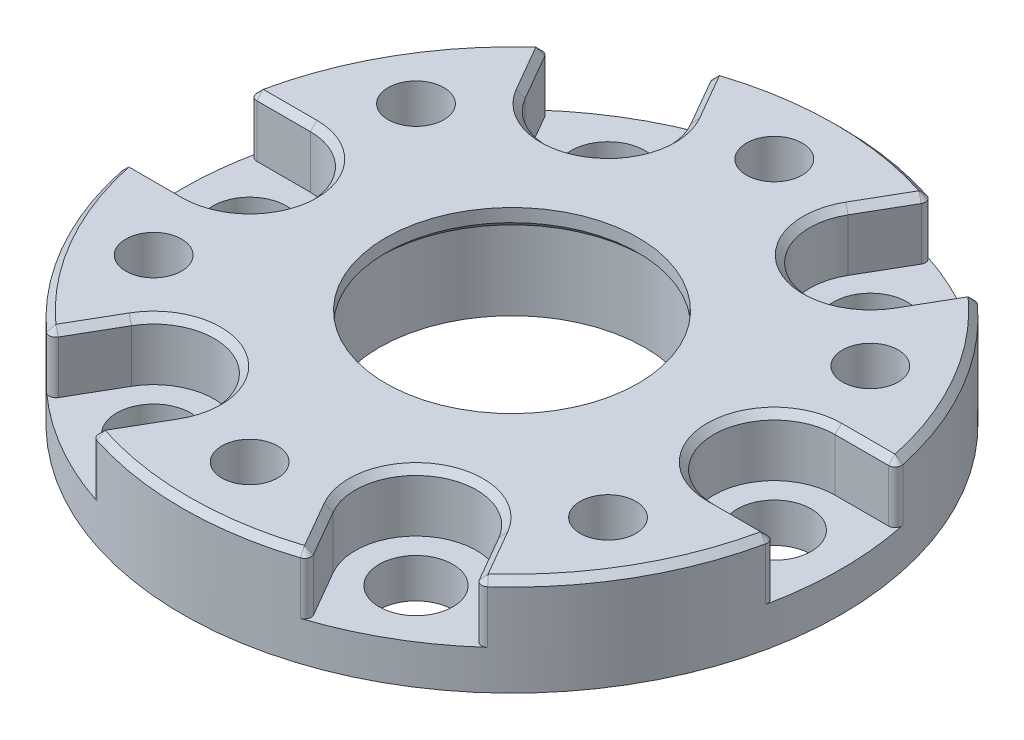
from build123d import *

# Parameters (mm, degrees)
CUT_EXTRUDE1_DEPTH           = 3.6
M4_CLEARANCE_HOLE1_D         = 4.5
CUT_EXTRUDE2_DEPTH           = 2.6
M3_CLEARANCE_HOLE2_D         = 3.4
FILLET1_R                    = 0.4
CHAMFER1_SIZE                = 1
CIRPATTERN1_COUNT            = 6
FILLET1_OF_CIRPATTERN1_R     = 0.4
CHAMFER1_OF_CIRPATTERN1_SIZE = 1
CHAMFER2_SIZE                = 0.4


with BuildPart() as part:
    # Sketch1 → Revolve1 (revolve)
    with BuildSketch(Plane.XY, mode=Mode.PRIVATE) as revolve1_sk:
        Polygon((8.1, 0), (20.1, 0), (20.1, 6), (7.7, 6), (7.7, 5.2), (8.1, 4.8), align=None)
    revolve(revolve1_sk.sketch.rotate(Axis((0, 16.469304641, 0), (0, -1, 0)), 180), axis=Axis((0, 16.469304641, 0), (0, -1, 0)))

    # Sketch2 → Cut-Extrude1 (cut)
    with BuildSketch(Plane(origin=(0, 6, 0), x_dir=(1, 0, 0), z_dir=(0, 1, 0))):
        with BuildLine():
            Line((16, 3.7), (19.756517912, 3.7))
            ThreePointArc((19.756517912, 3.7), (20.1, 0), (19.756517912, -3.7))
            Line((19.756517912, -3.7), (16, -3.7))
            ThreePointArc((16, -3.7), (12.3, 0), (16, 3.7))
        make_face()
    cut_extrude1 = extrude(amount=-CUT_EXTRUDE1_DEPTH, mode=Mode.SUBTRACT)

    # M4 Clearance Hole1 (through all)
    with Locations(Plane(origin=(0, 2.4, 0), x_dir=(1, 0, 0), z_dir=(0, 1, 0))):
        with Locations((16, 0)):
            m4_clearance_hole1 = Hole(M4_CLEARANCE_HOLE1_D / 2)

    # Sketch8 → Cut-Extrude2 (cut)
    with BuildSketch(Plane.XZ):
        Polygon((3.233161507, -16), (1.616580754, -13.2), (-1.616580754, -13.2), (-3.233161507, -16), (-1.616580754, -18.8), (1.616580754, -18.8), align=None)
    cut_extrude2 = extrude(amount=-CUT_EXTRUDE2_DEPTH, mode=Mode.SUBTRACT)

    # M3 Clearance Hole2 (through all)
    with Locations(Plane(origin=(0, 2.6, 0), x_dir=(-1, 0, 0), z_dir=(0, -1, 0))):
        with Locations((0, 16)):
            m3_clearance_hole2 = Hole(M3_CLEARANCE_HOLE2_D / 2)

    # Fillet1
    fillet1_edges = [part.edges().sort_by_distance(p)[0] for p in [
        (19.756517912, 4.2, -3.7),
        (19.756517912, 4.2, 3.7),
    ]]
    fillet(fillet1_edges, radius=FILLET1_R)

    # Chamfer1
    chamfer1_edges = [part.edges().sort_by_distance(p)[0] for p in [
        (-1.7, 2.6, -16),
    ]]
    chamfer(chamfer1_edges, length=CHAMFER1_SIZE)

    # CirPattern1: Cut-Extrude1, M4 Clearance Hole1, Cut-Extrude2, M3 Clearance Hole2 ×6 about axis
    cirpattern1_axis = Axis((0, 0, 0), (0, 1, 0))
    add([cut_extrude1.rotate(cirpattern1_axis, i * 360 / CIRPATTERN1_COUNT) for i in range(1, CIRPATTERN1_COUNT)], mode=Mode.SUBTRACT)
    add([m4_clearance_hole1.rotate(cirpattern1_axis, i * 360 / CIRPATTERN1_COUNT) for i in range(1, CIRPATTERN1_COUNT)], mode=Mode.SUBTRACT)
    add([cut_extrude2.rotate(cirpattern1_axis, i * 360 / CIRPATTERN1_COUNT) for i in range(1, CIRPATTERN1_COUNT)], mode=Mode.SUBTRACT)
    add([m3_clearance_hole2.rotate(cirpattern1_axis, i * 360 / CIRPATTERN1_COUNT) for i in range(1, CIRPATTERN1_COUNT)], mode=Mode.SUBTRACT)

    # Fillet1 of CirPattern1
    fillet1_of_cirpattern1_edges = [part.edges().sort_by_distance(p)[0] for p in [
        (6.673964962, 4.2, -18.959646402),
        (13.08255295, 4.2, -15.259646402),
        (-13.08255295, 4.2, -15.259646402),
        (-6.673964962, 4.2, -18.959646402),
        (-19.756517912, 4.2, 3.7),
        (-19.756517912, 4.2, -3.7),
        (-6.673964962, 4.2, 18.959646402),
        (-13.08255295, 4.2, 15.259646402),
        (13.08255295, 4.2, 15.259646402),
        (6.673964962, 4.2, 18.959646402),
    ]]
    fillet(fillet1_of_cirpattern1_edges, radius=FILLET1_OF_CIRPATTERN1_R)

    # Chamfer1 of CirPattern1
    chamfer1_of_cirpattern1_edges = [part.edges().sort_by_distance(p)[0] for p in [
        (-14.706406461, 2.6, -6.527756814),
        (-13.006406461, 2.6, 9.472243186),
        (1.7, 2.6, 16),
        (14.706406461, 2.6, 6.527756814),
        (13.006406461, 2.6, -9.472243186),
    ]]
    chamfer(chamfer1_of_cirpattern1_edges, length=CHAMFER1_OF_CIRPATTERN1_SIZE)

    # Chamfer2
    chamfer2_edges = [part.edges().sort_by_distance(p)[0] for p in [
        (6.15, 6, 10.652112467),
        (5.612862844, 6, 17.121763621),
        (-6.15, 6, 10.652112467),
        (-12.021450832, 6, 13.421763621),
        (-12.3, 6, 0),
        (-17.634313676, 6, -3.7),
        (-6.15, 6, -10.652112467),
        (-5.612862844, 6, -17.121763621),
        (6.15, 6, -10.652112467),
        (12.021450832, 6, -13.421763621),
        (12.3, 6, 0),
        (17.634313676, 6, 3.7),
        (5.612862844, 6, -17.121763621),
        (0, 6, -20.1),
        (13.122486484, 6, -15.032202838),
        (6.45702629, 6, -18.880508075),
        (-12.021450832, 6, -13.421763621),
        (-17.407110616, 6, -10.05),
        (-6.45702629, 6, -18.880508075),
        (-13.122486484, 6, -15.032202838),
        (-17.634313676, 6, 3.7),
        (-17.407110616, 6, 10.05),
        (-19.579512774, 6, -3.848305237),
        (-19.579512774, 6, 3.848305237),
        (-5.612862844, 6, 17.121763621),
        (0, 6, 20.1),
        (-13.122486484, 6, 15.032202838),
        (-6.45702629, 6, 18.880508075),
        (12.021450832, 6, 13.421763621),
        (17.407110616, 6, 10.05),
        (6.45702629, 6, 18.880508075),
        (13.122486484, 6, 15.032202838),
        (17.634313676, 6, -3.7),
        (17.407110616, 6, -10.05),
        (19.579512774, 6, 3.848305237),
        (19.579512774, 6, -3.848305237),
    ]]
    chamfer(chamfer2_edges, length=CHAMFER2_SIZE - 0.0001)  # a hair under: the kernel refuses the full size


solid = part.part
